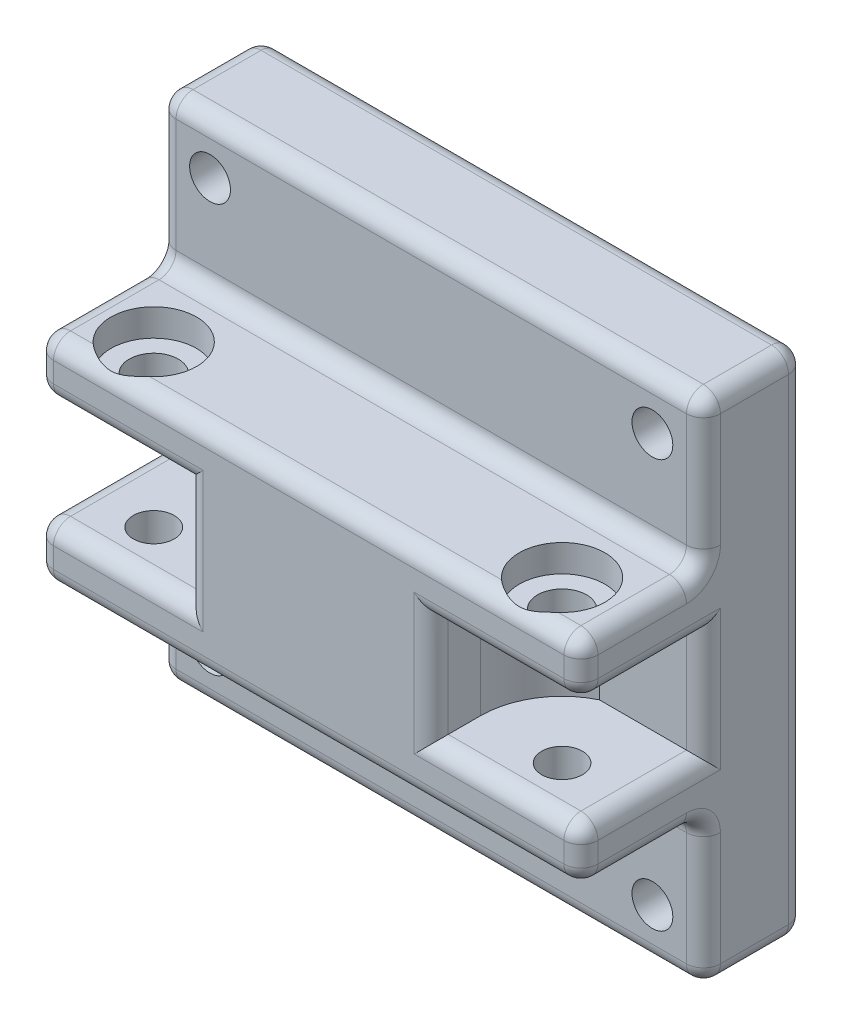
from build123d import *

# Parameters (mm, degrees)
SKETCH1_W           = 50.8
SKETCH1_H           = 47.625
BOSS_EXTRUDE1_DEPTH = 9.525
SKETCH2_R           = 1.905
CUT_EXTRUDE1_DEPTH  = 71.281620997
SKETCH3_W           = 50.8
SKETCH3_H           = 5.08
BOSS_EXTRUDE2_DEPTH = 11.43
CUT_EXTRUDE2_START  = -5.08
SKETCH4_R           = 2.286
CUT_EXTRUDE2_DEPTH  = 70.618902185
SKETCH5_R           = 4.0005
CUT_EXTRUDE3_DEPTH  = 2.54
BOSS_EXTRUDE3_DEPTH = 9.906
SKETCH9_R           = 1.905
CUT_EXTRUDE4_DEPTH  = 5.08
SKETCH11_R          = 1.905
CUT_EXTRUDE5_DEPTH  = 6.35
FILLET1_R           = 1.5875


with BuildPart() as part:
    # Sketch1 → Boss-Extrude1 (new body)
    with BuildSketch(Plane.XY):
        with Locations((25.4, 23.8125)):
            Rectangle(SKETCH1_W, SKETCH1_H)
    extrude(amount=BOSS_EXTRUDE1_DEPTH)

    # Sketch2 → Cut-Extrude1 (cut, through all)
    with BuildSketch(Plane.XY.offset(9.525)):
        with Locations((4.7625, 42.8625)):
            Circle(SKETCH2_R)
        with Locations((4.7625, 4.7625)):
            Circle(SKETCH2_R)
    cut_extrude1 = extrude(amount=-CUT_EXTRUDE1_DEPTH, mode=Mode.SUBTRACT)

    # Sketch3 → Boss-Extrude2 (add)
    with BuildSketch(Plane.XY.offset(9.525)):
        with Locations((25.4, 31.3055)):
            Rectangle(SKETCH3_W, SKETCH3_H)
        with Locations((25.4, 16.3195)):
            Rectangle(SKETCH3_W, SKETCH3_H)
    extrude(amount=BOSS_EXTRUDE2_DEPTH)

    # Sketch4 → Cut-Extrude2 (cut)
    with BuildSketch(Plane(origin=(0, 33.8455, 0), x_dir=(1, 0, 0), z_dir=(0, 1, 0)).offset(CUT_EXTRUDE2_START)):
        with Locations(Location((6.35, -16.36395, 0), (0, 0, 270))):
            Circle(SKETCH4_R)
    cut_extrude2 = extrude(amount=CUT_EXTRUDE2_DEPTH, mode=Mode.SUBTRACT)

    # Mirror3: Cut-Extrude1, Cut-Extrude2 across plane
    add(cut_extrude1.mirror(Plane(origin=(25.4, 0, 0), x_dir=(0, 0, 1), z_dir=(1, 0, 0))), mode=Mode.SUBTRACT)
    add(cut_extrude2.mirror(Plane(origin=(25.4, 0, 0), x_dir=(0, 0, 1), z_dir=(1, 0, 0))), mode=Mode.SUBTRACT)

    # Sketch5 → Cut-Extrude3 (cut)
    with BuildSketch(Plane(origin=(0, 33.8455, 0), x_dir=(1, 0, 0), z_dir=(0, 1, 0))):
        with Locations(Location((6.35, -16.36395, 0), (0, 0, 270))):
            Circle(SKETCH5_R)
        with Locations(Location((44.45, -16.36395, 0), (0, 0, 270))):
            Circle(SKETCH5_R)
    extrude(amount=-CUT_EXTRUDE3_DEPTH, mode=Mode.SUBTRACT)

    # Sketch8 → Boss-Extrude3 (add)
    with BuildSketch(Plane(origin=(0, 18.8595, 0), x_dir=(1, 0, 0), z_dir=(0, 1, 0))):
        with BuildLine():
            Line((36.83, -16.36395), (36.83, -20.955))
            Line((36.83, -20.955), (13.97, -20.955))
            Line((13.97, -20.955), (13.97, -16.36395))
            ThreePointArc((13.97, -16.36395), (12.818061524, -12.335478811), (9.710530151, -9.525))
            Line((9.710530151, -9.525), (41.089469849, -9.525))
            ThreePointArc((41.089469849, -9.525), (37.981938476, -12.335478811), (36.83, -16.36395))
        make_face()
    extrude(amount=BOSS_EXTRUDE3_DEPTH)

    # Sketch9 → Cut-Extrude4 (cut)
    with BuildSketch(Plane(origin=(0, 18.8595, 0), x_dir=(1, 0, 0), z_dir=(0, 1, 0))):
        with Locations(Location((44.45, -16.36395, 0), (0, 0, 270))):
            Circle(SKETCH9_R)
        with Locations(Location((6.35, -16.36395, 0), (0, 0, 270))):
            Circle(SKETCH9_R)
    extrude(amount=-CUT_EXTRUDE4_DEPTH, mode=Mode.SUBTRACT)

    # Sketch11 → Cut-Extrude5 (cut)
    with BuildSketch(Plane(origin=(0, 0, 0), x_dir=(-1, 0, 0), z_dir=(0, 0, -1))):
        with Locations((-44.45, 30.1625)):
            Circle(SKETCH11_R)
        with Locations((-44.45, 17.4625)):
            Circle(SKETCH11_R)
        with Locations(Location((-6.35, 17.4625, 0), (0, 0, 180))):
            Circle(SKETCH11_R)
        with Locations(Location((-6.35, 30.1625, 0), (0, 0, 180))):
            Circle(SKETCH11_R)
    extrude(amount=-CUT_EXTRUDE5_DEPTH, mode=Mode.SUBTRACT)

    # Fillet1
    # the kernel refuses this fillet: 1.5875 mm, written as the material it adds along each edge
    with BuildSketch(Plane(origin=(0, 33.8455, 9.525), x_dir=(0, 1, 0), z_dir=(1, 0, 0))) as fillet1_piece_1:
        with BuildLine():
            CenterArc((FILLET1_R, FILLET1_R), FILLET1_R, 180, 90)
            Line((0, FILLET1_R), (0, 0))
            Line((0, 0), (FILLET1_R, 0))
        make_face()
    extrude(amount=50.8)
    with BuildSketch(Plane(origin=(0, 13.7795, 9.525), x_dir=(0, -1, 0), z_dir=(1, 0, 0))) as fillet1_piece_2:
        with BuildLine():
            CenterArc((FILLET1_R, -FILLET1_R), FILLET1_R, 90, 90)
            Line((0, -FILLET1_R), (0, 0))
            Line((0, 0), (FILLET1_R, 0))
        make_face()
    extrude(amount=50.8)
    # the kernel refuses this fillet: 1.5875 mm, written as the material it takes off along each edge
    with BuildSketch(Plane(origin=(1.5875, 30.353, 19.3675), x_dir=(-1, 0, 0), z_dir=(0, 0, 1))) as fillet1_2_piece_1_section:
        Polygon((0, 0), (FILLET1_R, 0), (FILLET1_R, FILLET1_R), (0, FILLET1_R), align=None)
    fillet1_2_piece_1 = extrude(amount=FILLET1_R, mode=Mode.PRIVATE)
    fillet1_2_piece_1 = fillet1_2_piece_1 - Plane(origin=(1.5875, 30.353, 19.3675), x_dir=(0.7071067811865475, 0.7071067811865477, 0), z_dir=(0, 0, 1)) * Sphere(FILLET1_R, mode=Mode.PRIVATE)
    add(fillet1_2_piece_1, mode=Mode.SUBTRACT)
    with BuildSketch(Plane(origin=(49.2125, 30.353, 19.3675), x_dir=(1, 0, 0), z_dir=(0, 0, 1))) as fillet1_2_piece_2_section:
        Polygon((0, 0), (FILLET1_R, 0), (FILLET1_R, -FILLET1_R), (0, -FILLET1_R), align=None)
    fillet1_2_piece_2 = extrude(amount=FILLET1_R, mode=Mode.PRIVATE)
    fillet1_2_piece_2 = fillet1_2_piece_2 - Plane(origin=(49.2125, 30.353, 19.3675), x_dir=(-0.7071067811865476, 0.7071067811865475, 0), z_dir=(0, 0, 1)) * Sphere(FILLET1_R, mode=Mode.PRIVATE)
    add(fillet1_2_piece_2, mode=Mode.SUBTRACT)
    with BuildSketch(Plane(origin=(1.5875, 17.272, 19.3675), x_dir=(-1, 0, 0), z_dir=(0, 0, 1))) as fillet1_2_piece_3_section:
        Polygon((0, 0), (FILLET1_R, 0), (FILLET1_R, -FILLET1_R), (0, -FILLET1_R), align=None)
    fillet1_2_piece_3 = extrude(amount=FILLET1_R, mode=Mode.PRIVATE)
    fillet1_2_piece_3 = fillet1_2_piece_3 - Plane(origin=(1.5875, 17.272, 19.3675), x_dir=(0.7071067811865476, -0.7071067811865475, 0), z_dir=(0, 0, 1)) * Sphere(FILLET1_R, mode=Mode.PRIVATE)
    add(fillet1_2_piece_3, mode=Mode.SUBTRACT)
    with BuildSketch(Plane(origin=(49.2125, 17.272, 19.3675), x_dir=(1, 0, 0), z_dir=(0, 0, 1))) as fillet1_2_piece_4_section:
        Polygon((0, 0), (FILLET1_R, 0), (FILLET1_R, FILLET1_R), (0, FILLET1_R), align=None)
    fillet1_2_piece_4 = extrude(amount=FILLET1_R, mode=Mode.PRIVATE)
    fillet1_2_piece_4 = fillet1_2_piece_4 - Plane(origin=(49.2125, 17.272, 19.3675), x_dir=(-0.7071067811865475, -0.7071067811865477, 0), z_dir=(0, 0, 1)) * Sphere(FILLET1_R, mode=Mode.PRIVATE)
    add(fillet1_2_piece_4, mode=Mode.SUBTRACT)
    with BuildSketch(Plane(origin=(49.2125, 46.0375, 1.5875), x_dir=(0, 0, -1), z_dir=(1, 0, 0))) as fillet1_2_piece_5_section:
        Polygon((0, 0), (FILLET1_R, 0), (FILLET1_R, FILLET1_R), (0, FILLET1_R), align=None)
    fillet1_2_piece_5 = extrude(amount=FILLET1_R, mode=Mode.PRIVATE)
    fillet1_2_piece_5 = fillet1_2_piece_5 - Plane(origin=(49.2125, 46.0375, 1.5875), x_dir=(0, -0.7071067811865475, 0.7071067811865475), z_dir=(1, 0, 0)) * Sphere(FILLET1_R, mode=Mode.PRIVATE)
    add(fillet1_2_piece_5, mode=Mode.SUBTRACT)
    with BuildSketch(Plane(origin=(1.5875, 46.0375, 1.5875), x_dir=(0, 0, -1), z_dir=(-1, 0, 0))) as fillet1_2_piece_6_section:
        Polygon((0, 0), (FILLET1_R, 0), (FILLET1_R, -FILLET1_R), (0, -FILLET1_R), align=None)
    fillet1_2_piece_6 = extrude(amount=FILLET1_R, mode=Mode.PRIVATE)
    fillet1_2_piece_6 = fillet1_2_piece_6 - Plane(origin=(1.5875, 46.0375, 1.5875), x_dir=(0, -0.7071067811865475, 0.7071067811865475), z_dir=(-1, 0, 0)) * Sphere(FILLET1_R, mode=Mode.PRIVATE)
    add(fillet1_2_piece_6, mode=Mode.SUBTRACT)
    with BuildSketch(Plane(origin=(49.2125, 1.5875, 1.5875), x_dir=(1, 0, 0), z_dir=(0, -1, 0))) as fillet1_2_piece_7_section:
        Polygon((0, 0), (FILLET1_R, 0), (FILLET1_R, -FILLET1_R), (0, -FILLET1_R), align=None)
    fillet1_2_piece_7 = extrude(amount=FILLET1_R, mode=Mode.PRIVATE)
    fillet1_2_piece_7 = fillet1_2_piece_7 - Plane(origin=(49.2125, 1.5875, 1.5875), x_dir=(-0.7071067811865475, 0, 0.7071067811865475), z_dir=(0, -1, 0)) * Sphere(FILLET1_R, mode=Mode.PRIVATE)
    add(fillet1_2_piece_7, mode=Mode.SUBTRACT)
    with BuildSketch(Plane(origin=(1.5875, 1.5875, 1.5875), x_dir=(-1, 0, 0), z_dir=(0, -1, 0))) as fillet1_2_piece_8_section:
        Polygon((0, 0), (FILLET1_R, 0), (FILLET1_R, FILLET1_R), (0, FILLET1_R), align=None)
    fillet1_2_piece_8 = extrude(amount=FILLET1_R, mode=Mode.PRIVATE)
    fillet1_2_piece_8 = fillet1_2_piece_8 - Plane(origin=(1.5875, 1.5875, 1.5875), x_dir=(0.7071067811865475, 0, 0.7071067811865475), z_dir=(0, -1, 0)) * Sphere(FILLET1_R, mode=Mode.PRIVATE)
    add(fillet1_2_piece_8, mode=Mode.SUBTRACT)
    with BuildSketch(Plane(origin=(54.76875, 47.625, 9.525), x_dir=(0, 0, -1), z_dir=(-1, 0, 0)), Plane(origin=(-3.96875, 0, 9.525), x_dir=(0, 0, -1), z_dir=(1, 0, 0))) as fillet1_2_piece_9:
        with BuildLine():
            CenterArc((FILLET1_R, FILLET1_R), FILLET1_R, 180, 90)
            Line((0, FILLET1_R), (0, 0))
            Line((0, 0), (FILLET1_R, 0))
        make_face()
    extrude(amount=58.7375, mode=Mode.SUBTRACT)
    with BuildSketch(Plane(origin=(0, 28.7655, 9.525), x_dir=(0, 0, -1), z_dir=(0, -1, 0)), Plane(origin=(50.8, 18.8595, 9.525), x_dir=(0, 0, -1), z_dir=(0, 1, 0)), Plane(origin=(13.97, 18.8595, 20.955), x_dir=(1, 0, 0), z_dir=(0, 1, 0))) as fillet1_2_piece_10:
        with BuildLine():
            CenterArc((FILLET1_R, FILLET1_R), FILLET1_R, 180, 90)
            Line((0, FILLET1_R), (0, 0))
            Line((0, 0), (FILLET1_R, 0))
        make_face()
    extrude(amount=9.906, mode=Mode.SUBTRACT)
    with BuildSketch(Plane(origin=(0, 28.7655, 9.525), x_dir=(0, 1, 0), z_dir=(0, 0, 1)), Plane(origin=(50.8, 18.8595, 9.525), x_dir=(0, -1, 0), z_dir=(0, 0, 1))) as fillet1_2_piece_11:
        with BuildLine():
            CenterArc((FILLET1_R, -FILLET1_R), FILLET1_R, 90, 90)
            Line((0, -FILLET1_R), (0, 0))
            Line((0, 0), (FILLET1_R, 0))
        make_face()
    extrude(amount=9.8425, mode=Mode.SUBTRACT)
    with BuildSketch(Plane(origin=(50.8, 28.7655, 9.525), x_dir=(0, 1, 0), z_dir=(0, 0, 1)), Plane(origin=(0, 18.8595, 9.525), x_dir=(0, -1, 0), z_dir=(0, 0, 1))) as fillet1_2_piece_12:
        with BuildLine():
            CenterArc((FILLET1_R, FILLET1_R), FILLET1_R, 180, 90)
            Line((0, FILLET1_R), (0, 0))
            Line((0, 0), (FILLET1_R, 0))
        make_face()
    extrude(amount=9.8425, mode=Mode.SUBTRACT)
    with BuildSketch(Plane(origin=(0, 30.353, 20.955), x_dir=(0, 0, -1), z_dir=(0, 1, 0)), Plane(origin=(50.8, 37.81425, 20.955), x_dir=(0, 0, -1), z_dir=(0, -1, 0))) as fillet1_2_piece_13:
        with BuildLine():
            CenterArc((FILLET1_R, -FILLET1_R), FILLET1_R, 90, 90)
            Line((0, -FILLET1_R), (0, 0))
            Line((0, 0), (FILLET1_R, 0))
        make_face()
    extrude(amount=7.46125, mode=Mode.SUBTRACT)
    with BuildSketch(Plane(origin=(13.97, 28.7655, 20.955), x_dir=(0, 1, 0), z_dir=(-1, 0, 0)), Plane(origin=(49.2125, 28.7655, 20.955), x_dir=(0, 1, 0), z_dir=(-1, 0, 0))) as fillet1_2_piece_14:
        with BuildLine():
            CenterArc((FILLET1_R, FILLET1_R), FILLET1_R, 180, 90)
            Line((0, FILLET1_R), (0, 0))
            Line((0, 0), (FILLET1_R, 0))
        make_face()
    extrude(amount=12.3825, mode=Mode.SUBTRACT)
    with BuildSketch(Plane(origin=(-3.96875, 33.8455, 20.955), x_dir=(0, 0, -1), z_dir=(1, 0, 0)), Plane(origin=(-3.96875, 13.7795, 20.955), x_dir=(0, 1, 0), z_dir=(1, 0, 0))) as fillet1_2_piece_15:
        with BuildLine():
            CenterArc((FILLET1_R, -FILLET1_R), FILLET1_R, 90, 90)
            Line((0, -FILLET1_R), (0, 0))
            Line((0, 0), (FILLET1_R, 0))
        make_face()
    extrude(amount=58.7375, mode=Mode.SUBTRACT)
    with BuildSketch(Plane(origin=(0, 17.272, 20.955), x_dir=(0, 0, -1), z_dir=(0, -1, 0)), Plane(origin=(50.8, 9.81075, 20.955), x_dir=(0, 0, -1), z_dir=(0, 1, 0))) as fillet1_2_piece_16:
        with BuildLine():
            CenterArc((FILLET1_R, FILLET1_R), FILLET1_R, 180, 90)
            Line((0, FILLET1_R), (0, 0))
            Line((0, 0), (FILLET1_R, 0))
        make_face()
    extrude(amount=7.46125, mode=Mode.SUBTRACT)
    with BuildSketch(Plane(origin=(49.2125, 18.8595, 20.955), x_dir=(0, -1, 0), z_dir=(-1, 0, 0)), Plane(origin=(13.97, 18.8595, 20.955), x_dir=(0, -1, 0), z_dir=(-1, 0, 0))) as fillet1_2_piece_17:
        with BuildLine():
            CenterArc((FILLET1_R, -FILLET1_R), FILLET1_R, 90, 90)
            Line((0, -FILLET1_R), (0, 0))
            Line((0, 0), (FILLET1_R, 0))
        make_face()
    extrude(amount=12.3825, mode=Mode.SUBTRACT)
    with BuildSketch(Plane(origin=(49.2125, 47.625, 0), x_dir=(0, -1, 0), z_dir=(-1, 0, 0))) as fillet1_2_piece_18:
        with BuildLine():
            CenterArc((FILLET1_R, FILLET1_R), FILLET1_R, 180, 90)
            Line((0, FILLET1_R), (0, 0))
            Line((0, 0), (FILLET1_R, 0))
        make_face()
    extrude(amount=47.625, mode=Mode.SUBTRACT)
    with BuildSketch(Plane(origin=(50.8, 1.5875, 0), x_dir=(0, 0, 1), z_dir=(0, 1, 0)), Plane(origin=(0, 46.0375, 0), x_dir=(0, 0, 1), z_dir=(0, -1, 0))) as fillet1_2_piece_19:
        with BuildLine():
            CenterArc((FILLET1_R, -FILLET1_R), FILLET1_R, 90, 90)
            Line((0, -FILLET1_R), (0, 0))
            Line((0, 0), (FILLET1_R, 0))
        make_face()
    extrude(amount=44.45, mode=Mode.SUBTRACT)
    with BuildSketch(Plane(origin=(1.5875, 0, 0), x_dir=(0, 0, 1), z_dir=(1, 0, 0))) as fillet1_2_piece_20:
        with BuildLine():
            CenterArc((FILLET1_R, -FILLET1_R), FILLET1_R, 90, 90)
            Line((0, -FILLET1_R), (0, 0))
            Line((0, 0), (FILLET1_R, 0))
        make_face()
    extrude(amount=47.625, mode=Mode.SUBTRACT)
    with BuildSketch(Plane(origin=(0, 47.625, 1.5875), x_dir=(0, -1, 0), z_dir=(0, 0, 1)), Plane(origin=(0, 0, 1.5875), x_dir=(1, 0, 0), z_dir=(0, 0, 1))) as fillet1_2_piece_21:
        with BuildLine():
            CenterArc((FILLET1_R, FILLET1_R), FILLET1_R, 180, 90)
            Line((0, FILLET1_R), (0, 0))
            Line((0, 0), (FILLET1_R, 0))
        make_face()
    extrude(amount=11.90625, mode=Mode.SUBTRACT)
    with BuildSketch(Plane(origin=(50.8, 47.625, 1.5875), x_dir=(0, -1, 0), z_dir=(0, 0, 1)), Plane(origin=(50.8, 0, 1.5875), x_dir=(-1, 0, 0), z_dir=(0, 0, 1))) as fillet1_2_piece_22:
        with BuildLine():
            CenterArc((FILLET1_R, -FILLET1_R), FILLET1_R, 90, 90)
            Line((0, -FILLET1_R), (0, 0))
            Line((0, 0), (FILLET1_R, 0))
        make_face()
    extrude(amount=11.90625, mode=Mode.SUBTRACT)
    with BuildSketch(Plane(origin=(36.83, 18.8595, 20.955), x_dir=(-1, 0, 0), z_dir=(0, 1, 0))) as fillet1_2_piece_23:
        with BuildLine():
            CenterArc((FILLET1_R, -FILLET1_R), FILLET1_R, 90, 90)
            Line((0, -FILLET1_R), (0, 0))
            Line((0, 0), (FILLET1_R, 0))
        make_face()
    extrude(amount=9.906, mode=Mode.SUBTRACT)
    with BuildSketch(Plane(origin=(0, 28.7655, 5.55625), x_dir=(0, 1, 0), z_dir=(0, 0, 1))) as fillet1_2_piece_24a_section:
        with BuildLine():
            CenterArc((FILLET1_R, -FILLET1_R), FILLET1_R, 90, 90)
            Line((0, -FILLET1_R), (0, 0))
            Line((0, 0), (FILLET1_R, 0))
        make_face()
    fillet1_2_piece_24a = extrude(amount=13.81125, mode=Mode.PRIVATE)
    fillet1_2_piece_24a = split(fillet1_2_piece_24a, bisect_by=Plane(origin=(0.359402244, 29.124902244, 9.525), z_dir=(0, 0, -1)), keep=Keep.TOP, mode=Mode.PRIVATE)
    with BuildSketch(Plane(origin=(0, 32.73425, 9.525), x_dir=(0, 0, -1), z_dir=(0, -1, 0))) as fillet1_2_piece_24b_section:
        with BuildLine():
            CenterArc((FILLET1_R, FILLET1_R), FILLET1_R, 180, 90)
            Line((0, FILLET1_R), (0, 0))
            Line((0, 0), (FILLET1_R, 0))
        make_face()
    fillet1_2_piece_24b = extrude(amount=13.87475, mode=Mode.PRIVATE)
    fillet1_2_piece_24b = split(fillet1_2_piece_24b, bisect_by=Plane(origin=(0.359402244, 28.7655, 9.165597756), z_dir=(0, 1, 0)), keep=Keep.TOP, mode=Mode.PRIVATE)
    fillet1_2_piece_24 = fillet1_2_piece_24a & fillet1_2_piece_24b
    add(fillet1_2_piece_24, mode=Mode.SUBTRACT)
    with BuildSketch(Plane(origin=(0, 28.7655, 9.525), x_dir=(0, 0, -1), z_dir=(0, -1, 0))) as fillet1_2_piece_25a_section:
        with BuildLine():
            CenterArc((FILLET1_R, FILLET1_R), FILLET1_R, 180, 90)
            Line((0, FILLET1_R), (0, 0))
            Line((0, 0), (FILLET1_R, 0))
        make_face()
    fillet1_2_piece_25a = extrude(amount=13.87475, mode=Mode.PRIVATE)
    fillet1_2_piece_25a = split(fillet1_2_piece_25a, bisect_by=Plane(origin=(0.359402244, 18.8595, 9.165597756), z_dir=(0, -1, 0)), keep=Keep.TOP, mode=Mode.PRIVATE)
    with BuildSketch(Plane(origin=(0, 18.8595, 5.55625), x_dir=(0, -1, 0), z_dir=(0, 0, 1))) as fillet1_2_piece_25b_section:
        with BuildLine():
            CenterArc((FILLET1_R, FILLET1_R), FILLET1_R, 180, 90)
            Line((0, FILLET1_R), (0, 0))
            Line((0, 0), (FILLET1_R, 0))
        make_face()
    fillet1_2_piece_25b = extrude(amount=13.81125, mode=Mode.PRIVATE)
    fillet1_2_piece_25b = split(fillet1_2_piece_25b, bisect_by=Plane(origin=(0.359402244, 18.500097756, 9.525), z_dir=(0, 0, -1)), keep=Keep.TOP, mode=Mode.PRIVATE)
    fillet1_2_piece_25 = fillet1_2_piece_25a & fillet1_2_piece_25b
    add(fillet1_2_piece_25, mode=Mode.SUBTRACT)
    with BuildSketch(Plane(origin=(50.8, 18.8595, 9.525), x_dir=(0, 0, -1), z_dir=(0, 1, 0))) as fillet1_2_piece_26a_section:
        with BuildLine():
            CenterArc((FILLET1_R, FILLET1_R), FILLET1_R, 180, 90)
            Line((0, FILLET1_R), (0, 0))
            Line((0, 0), (FILLET1_R, 0))
        make_face()
    fillet1_2_piece_26a = extrude(amount=13.87475, mode=Mode.PRIVATE)
    fillet1_2_piece_26a = split(fillet1_2_piece_26a, bisect_by=Plane(origin=(50.440597756, 28.7655, 9.165597756), z_dir=(0, 1, 0)), keep=Keep.TOP, mode=Mode.PRIVATE)
    with BuildSketch(Plane(origin=(50.8, 28.7655, 5.55625), x_dir=(0, 1, 0), z_dir=(0, 0, 1))) as fillet1_2_piece_26b_section:
        with BuildLine():
            CenterArc((FILLET1_R, FILLET1_R), FILLET1_R, 180, 90)
            Line((0, FILLET1_R), (0, 0))
            Line((0, 0), (FILLET1_R, 0))
        make_face()
    fillet1_2_piece_26b = extrude(amount=13.81125, mode=Mode.PRIVATE)
    fillet1_2_piece_26b = split(fillet1_2_piece_26b, bisect_by=Plane(origin=(50.440597756, 29.124902244, 9.525), z_dir=(0, 0, -1)), keep=Keep.TOP, mode=Mode.PRIVATE)
    fillet1_2_piece_26 = fillet1_2_piece_26a & fillet1_2_piece_26b
    add(fillet1_2_piece_26, mode=Mode.SUBTRACT)
    with BuildSketch(Plane(origin=(13.97, 18.8595, 20.955), x_dir=(1, 0, 0), z_dir=(0, 1, 0))) as fillet1_2_piece_27a_section:
        with BuildLine():
            CenterArc((FILLET1_R, FILLET1_R), FILLET1_R, 180, 90)
            Line((0, FILLET1_R), (0, 0))
            Line((0, 0), (FILLET1_R, 0))
        make_face()
    fillet1_2_piece_27a = extrude(amount=13.87475, mode=Mode.PRIVATE)
    fillet1_2_piece_27a = split(fillet1_2_piece_27a, bisect_by=Plane(origin=(14.329402244, 28.7655, 20.595597756), z_dir=(0, 1, 0)), keep=Keep.TOP, mode=Mode.PRIVATE)
    with BuildSketch(Plane(origin=(17.93875, 28.7655, 20.955), x_dir=(0, 1, 0), z_dir=(-1, 0, 0))) as fillet1_2_piece_27b_section:
        with BuildLine():
            CenterArc((FILLET1_R, FILLET1_R), FILLET1_R, 180, 90)
            Line((0, FILLET1_R), (0, 0))
            Line((0, 0), (FILLET1_R, 0))
        make_face()
    fillet1_2_piece_27b = extrude(amount=16.35125, mode=Mode.PRIVATE)
    fillet1_2_piece_27b = split(fillet1_2_piece_27b, bisect_by=Plane(origin=(13.97, 29.124902244, 20.595597756), z_dir=(1, 0, 0)), keep=Keep.TOP, mode=Mode.PRIVATE)
    fillet1_2_piece_27 = fillet1_2_piece_27a & fillet1_2_piece_27b
    add(fillet1_2_piece_27, mode=Mode.SUBTRACT)
    with BuildSketch(Plane(origin=(50.8, 18.8595, 5.55625), x_dir=(0, -1, 0), z_dir=(0, 0, 1))) as fillet1_2_piece_28a_section:
        with BuildLine():
            CenterArc((FILLET1_R, -FILLET1_R), FILLET1_R, 90, 90)
            Line((0, -FILLET1_R), (0, 0))
            Line((0, 0), (FILLET1_R, 0))
        make_face()
    fillet1_2_piece_28a = extrude(amount=13.81125, mode=Mode.PRIVATE)
    fillet1_2_piece_28a = split(fillet1_2_piece_28a, bisect_by=Plane(origin=(50.440597756, 18.500097756, 9.525), z_dir=(0, 0, -1)), keep=Keep.TOP, mode=Mode.PRIVATE)
    with BuildSketch(Plane(origin=(50.8, 14.89075, 9.525), x_dir=(0, 0, -1), z_dir=(0, 1, 0))) as fillet1_2_piece_28b_section:
        with BuildLine():
            CenterArc((FILLET1_R, FILLET1_R), FILLET1_R, 180, 90)
            Line((0, FILLET1_R), (0, 0))
            Line((0, 0), (FILLET1_R, 0))
        make_face()
    fillet1_2_piece_28b = extrude(amount=13.87475, mode=Mode.PRIVATE)
    fillet1_2_piece_28b = split(fillet1_2_piece_28b, bisect_by=Plane(origin=(50.440597756, 18.8595, 9.165597756), z_dir=(0, -1, 0)), keep=Keep.TOP, mode=Mode.PRIVATE)
    fillet1_2_piece_28 = fillet1_2_piece_28a & fillet1_2_piece_28b
    add(fillet1_2_piece_28, mode=Mode.SUBTRACT)
    with BuildSketch(Plane(origin=(36.83, 14.89075, 20.955), x_dir=(-1, 0, 0), z_dir=(0, 1, 0))) as fillet1_2_piece_29a_section:
        with BuildLine():
            CenterArc((FILLET1_R, -FILLET1_R), FILLET1_R, 90, 90)
            Line((0, -FILLET1_R), (0, 0))
            Line((0, 0), (FILLET1_R, 0))
        make_face()
    fillet1_2_piece_29a = extrude(amount=13.87475, mode=Mode.PRIVATE)
    fillet1_2_piece_29a = split(fillet1_2_piece_29a, bisect_by=Plane(origin=(36.470597756, 18.8595, 20.595597756), z_dir=(0, -1, 0)), keep=Keep.TOP, mode=Mode.PRIVATE)
    with BuildSketch(Plane(origin=(49.2125, 18.8595, 20.955), x_dir=(0, -1, 0), z_dir=(-1, 0, 0))) as fillet1_2_piece_29b_section:
        with BuildLine():
            CenterArc((FILLET1_R, -FILLET1_R), FILLET1_R, 90, 90)
            Line((0, -FILLET1_R), (0, 0))
            Line((0, 0), (FILLET1_R, 0))
        make_face()
    fillet1_2_piece_29b = extrude(amount=16.35125, mode=Mode.PRIVATE)
    fillet1_2_piece_29b = split(fillet1_2_piece_29b, bisect_by=Plane(origin=(36.83, 18.500097756, 20.595597756), z_dir=(-1, 0, 0)), keep=Keep.TOP, mode=Mode.PRIVATE)
    fillet1_2_piece_29 = fillet1_2_piece_29a & fillet1_2_piece_29b
    add(fillet1_2_piece_29, mode=Mode.SUBTRACT)
    with BuildSketch(Plane(origin=(17.93875, 18.8595, 20.955), x_dir=(0, -1, 0), z_dir=(-1, 0, 0))) as fillet1_2_piece_30a_section:
        with BuildLine():
            CenterArc((FILLET1_R, -FILLET1_R), FILLET1_R, 90, 90)
            Line((0, -FILLET1_R), (0, 0))
            Line((0, 0), (FILLET1_R, 0))
        make_face()
    fillet1_2_piece_30a = extrude(amount=16.35125, mode=Mode.PRIVATE)
    fillet1_2_piece_30a = split(fillet1_2_piece_30a, bisect_by=Plane(origin=(13.97, 18.500097756, 20.595597756), z_dir=(1, 0, 0)), keep=Keep.TOP, mode=Mode.PRIVATE)
    with BuildSketch(Plane(origin=(13.97, 14.89075, 20.955), x_dir=(1, 0, 0), z_dir=(0, 1, 0))) as fillet1_2_piece_30b_section:
        with BuildLine():
            CenterArc((FILLET1_R, FILLET1_R), FILLET1_R, 180, 90)
            Line((0, FILLET1_R), (0, 0))
            Line((0, 0), (FILLET1_R, 0))
        make_face()
    fillet1_2_piece_30b = extrude(amount=13.87475, mode=Mode.PRIVATE)
    fillet1_2_piece_30b = split(fillet1_2_piece_30b, bisect_by=Plane(origin=(14.329402244, 18.8595, 20.595597756), z_dir=(0, -1, 0)), keep=Keep.TOP, mode=Mode.PRIVATE)
    fillet1_2_piece_30 = fillet1_2_piece_30a & fillet1_2_piece_30b
    add(fillet1_2_piece_30, mode=Mode.SUBTRACT)
    with BuildSketch(Plane(origin=(49.2125, 28.7655, 20.955), x_dir=(0, 1, 0), z_dir=(-1, 0, 0))) as fillet1_2_piece_31a_section:
        with BuildLine():
            CenterArc((FILLET1_R, FILLET1_R), FILLET1_R, 180, 90)
            Line((0, FILLET1_R), (0, 0))
            Line((0, 0), (FILLET1_R, 0))
        make_face()
    fillet1_2_piece_31a = extrude(amount=16.35125, mode=Mode.PRIVATE)
    fillet1_2_piece_31a = split(fillet1_2_piece_31a, bisect_by=Plane(origin=(36.83, 29.124902244, 20.595597756), z_dir=(-1, 0, 0)), keep=Keep.TOP, mode=Mode.PRIVATE)
    with BuildSketch(Plane(origin=(36.83, 18.8595, 20.955), x_dir=(-1, 0, 0), z_dir=(0, 1, 0))) as fillet1_2_piece_31b_section:
        with BuildLine():
            CenterArc((FILLET1_R, -FILLET1_R), FILLET1_R, 90, 90)
            Line((0, -FILLET1_R), (0, 0))
            Line((0, 0), (FILLET1_R, 0))
        make_face()
    fillet1_2_piece_31b = extrude(amount=13.87475, mode=Mode.PRIVATE)
    fillet1_2_piece_31b = split(fillet1_2_piece_31b, bisect_by=Plane(origin=(36.470597756, 28.7655, 20.595597756), z_dir=(0, 1, 0)), keep=Keep.TOP, mode=Mode.PRIVATE)
    fillet1_2_piece_31 = fillet1_2_piece_31a & fillet1_2_piece_31b
    add(fillet1_2_piece_31, mode=Mode.SUBTRACT)
    # the kernel refuses this fillet: 1.5875 mm, written as the material it takes off along each edge
    with BuildSketch(Plane(origin=(1.5875, 46.0375, 7.9375), x_dir=(0, 0, 1), z_dir=(-1, 0, 0))) as fillet1_3_piece_1_section:
        Polygon((0, 0), (FILLET1_R, 0), (FILLET1_R, FILLET1_R), (0, FILLET1_R), align=None)
    fillet1_3_piece_1 = extrude(amount=FILLET1_R, mode=Mode.PRIVATE)
    fillet1_3_piece_1 = fillet1_3_piece_1 - Plane(origin=(1.5875, 46.0375, 7.9375), x_dir=(0, -0.7071067811865475, -0.7071067811865475), z_dir=(-1, 0, 0)) * Sphere(FILLET1_R, mode=Mode.PRIVATE)
    add(fillet1_3_piece_1, mode=Mode.SUBTRACT)
    with BuildSketch(Plane(origin=(49.2125, 15.367, 19.3675), x_dir=(0, -1, 0), z_dir=(1, 0, 0))) as fillet1_3_piece_2_section:
        Polygon((0, 0), (FILLET1_R, 0), (FILLET1_R, -FILLET1_R), (0, -FILLET1_R), align=None)
    fillet1_3_piece_2 = extrude(amount=FILLET1_R, mode=Mode.PRIVATE)
    fillet1_3_piece_2 = fillet1_3_piece_2 - Plane(origin=(49.2125, 15.367, 19.3675), x_dir=(0, 0.7071067811865475, -0.7071067811865475), z_dir=(1, 0, 0)) * Sphere(FILLET1_R, mode=Mode.PRIVATE)
    add(fillet1_3_piece_2, mode=Mode.SUBTRACT)
    with BuildSketch(Plane(origin=(1.5875, 15.367, 19.3675), x_dir=(0, -1, 0), z_dir=(-1, 0, 0))) as fillet1_3_piece_3_section:
        Polygon((0, 0), (FILLET1_R, 0), (FILLET1_R, FILLET1_R), (0, FILLET1_R), align=None)
    fillet1_3_piece_3 = extrude(amount=FILLET1_R, mode=Mode.PRIVATE)
    fillet1_3_piece_3 = fillet1_3_piece_3 - Plane(origin=(1.5875, 15.367, 19.3675), x_dir=(0, 0.7071067811865475, -0.7071067811865475), z_dir=(-1, 0, 0)) * Sphere(FILLET1_R, mode=Mode.PRIVATE)
    add(fillet1_3_piece_3, mode=Mode.SUBTRACT)
    with BuildSketch(Plane(origin=(1.5875, 1.5875, 7.9375), x_dir=(0, 0, 1), z_dir=(-1, 0, 0))) as fillet1_3_piece_4_section:
        Polygon((0, 0), (FILLET1_R, 0), (FILLET1_R, -FILLET1_R), (0, -FILLET1_R), align=None)
    fillet1_3_piece_4 = extrude(amount=FILLET1_R, mode=Mode.PRIVATE)
    fillet1_3_piece_4 = fillet1_3_piece_4 - Plane(origin=(1.5875, 1.5875, 7.9375), x_dir=(0, 0.7071067811865475, -0.7071067811865475), z_dir=(-1, 0, 0)) * Sphere(FILLET1_R, mode=Mode.PRIVATE)
    add(fillet1_3_piece_4, mode=Mode.SUBTRACT)
    with BuildSketch(Plane(origin=(49.2125, 32.258, 19.3675), x_dir=(0, 1, 0), z_dir=(1, 0, 0))) as fillet1_3_piece_5_section:
        Polygon((0, 0), (FILLET1_R, 0), (FILLET1_R, FILLET1_R), (0, FILLET1_R), align=None)
    fillet1_3_piece_5 = extrude(amount=FILLET1_R, mode=Mode.PRIVATE)
    fillet1_3_piece_5 = fillet1_3_piece_5 - Plane(origin=(49.2125, 32.258, 19.3675), x_dir=(0, -0.7071067811865475, -0.7071067811865475), z_dir=(1, 0, 0)) * Sphere(FILLET1_R, mode=Mode.PRIVATE)
    add(fillet1_3_piece_5, mode=Mode.SUBTRACT)
    with BuildSketch(Plane(origin=(1.5875, 32.258, 19.3675), x_dir=(0, 1, 0), z_dir=(-1, 0, 0))) as fillet1_3_piece_6_section:
        Polygon((0, 0), (FILLET1_R, 0), (FILLET1_R, -FILLET1_R), (0, -FILLET1_R), align=None)
    fillet1_3_piece_6 = extrude(amount=FILLET1_R, mode=Mode.PRIVATE)
    fillet1_3_piece_6 = fillet1_3_piece_6 - Plane(origin=(1.5875, 32.258, 19.3675), x_dir=(0, -0.7071067811865475, -0.7071067811865475), z_dir=(-1, 0, 0)) * Sphere(FILLET1_R, mode=Mode.PRIVATE)
    add(fillet1_3_piece_6, mode=Mode.SUBTRACT)
    with BuildSketch(Plane(origin=(49.2125, 46.0375, 7.9375), x_dir=(0, 0, 1), z_dir=(1, 0, 0))) as fillet1_3_piece_7_section:
        Polygon((0, 0), (FILLET1_R, 0), (FILLET1_R, -FILLET1_R), (0, -FILLET1_R), align=None)
    fillet1_3_piece_7 = extrude(amount=FILLET1_R, mode=Mode.PRIVATE)
    fillet1_3_piece_7 = fillet1_3_piece_7 - Plane(origin=(49.2125, 46.0375, 7.9375), x_dir=(0, -0.7071067811865475, -0.7071067811865475), z_dir=(1, 0, 0)) * Sphere(FILLET1_R, mode=Mode.PRIVATE)
    add(fillet1_3_piece_7, mode=Mode.SUBTRACT)
    with BuildSketch(Plane(origin=(49.2125, 1.5875, 7.9375), x_dir=(1, 0, 0), z_dir=(0, 0, 1))) as fillet1_3_piece_8_section:
        Polygon((0, 0), (FILLET1_R, 0), (FILLET1_R, -FILLET1_R), (0, -FILLET1_R), align=None)
    fillet1_3_piece_8 = extrude(amount=FILLET1_R, mode=Mode.PRIVATE)
    fillet1_3_piece_8 = fillet1_3_piece_8 - Plane(origin=(49.2125, 1.5875, 7.9375), x_dir=(-0.7071067811865476, 0.7071067811865475, 0), z_dir=(0, 0, 1)) * Sphere(FILLET1_R, mode=Mode.PRIVATE)
    add(fillet1_3_piece_8, mode=Mode.SUBTRACT)
    with BuildSketch(Plane(origin=(50.8, 1.5875, 9.525), x_dir=(-1, 0, 0), z_dir=(0, 1, 0))) as fillet1_3_piece_9:
        with BuildLine():
            CenterArc((FILLET1_R, -FILLET1_R), FILLET1_R, 90, 90)
            Line((0, -FILLET1_R), (0, 0))
            Line((0, 0), (FILLET1_R, 0))
        make_face()
    extrude(amount=10.6045, mode=Mode.SUBTRACT)
    with BuildSketch(Plane(origin=(50.8, 35.433, 9.525), x_dir=(0, 0, -1), z_dir=(0, 1, 0)), Plane(origin=(0, 12.192, 9.525), x_dir=(0, 0, -1), z_dir=(0, -1, 0)), Plane(origin=(0, 46.0375, 9.525), x_dir=(0, 0, -1), z_dir=(0, -1, 0))) as fillet1_3_piece_10:
        with BuildLine():
            CenterArc((FILLET1_R, FILLET1_R), FILLET1_R, 180, 90)
            Line((0, FILLET1_R), (0, 0))
            Line((0, 0), (FILLET1_R, 0))
        make_face()
    extrude(amount=10.6045, mode=Mode.SUBTRACT)
    with BuildSketch(Plane(origin=(0, 33.8455, 11.1125), x_dir=(0, -1, 0), z_dir=(0, 0, 1)), Plane(origin=(50.8, 13.7795, 11.1125), x_dir=(0, 1, 0), z_dir=(0, 0, 1))) as fillet1_3_piece_11:
        with BuildLine():
            CenterArc((FILLET1_R, FILLET1_R), FILLET1_R, 180, 90)
            Line((0, FILLET1_R), (0, 0))
            Line((0, 0), (FILLET1_R, 0))
        make_face()
    extrude(amount=8.255, mode=Mode.SUBTRACT)
    with BuildSketch(Plane(origin=(50.8, 33.8455, 11.1125), x_dir=(0, -1, 0), z_dir=(0, 0, 1)), Plane(origin=(0, 13.7795, 11.1125), x_dir=(0, 1, 0), z_dir=(0, 0, 1))) as fillet1_3_piece_12:
        with BuildLine():
            CenterArc((FILLET1_R, -FILLET1_R), FILLET1_R, 90, 90)
            Line((0, -FILLET1_R), (0, 0))
            Line((0, 0), (FILLET1_R, 0))
        make_face()
    extrude(amount=8.255, mode=Mode.SUBTRACT)
    with BuildSketch(Plane(origin=(0, 35.433, 11.1125), x_dir=(0, 0, -1), z_dir=(0, 1, 0))) as fillet1_3_piece_13:
        with BuildLine():
            CenterArc((1.5875 + FILLET1_R, -FILLET1_R), FILLET1_R, 90, 90)
            Line((1.5875, -FILLET1_R), (1.5875, 0))
            Line((1.5875, 0), (1.5875 + FILLET1_R, 0))
        make_face()
    revolve(axis=Axis((0, 35.433, 11.1125), (-1, 0, 0)), revolution_arc=90, mode=Mode.SUBTRACT)
    with BuildSketch(Plane(origin=(50.8, 12.192, 11.1125), x_dir=(0, 0, -1), z_dir=(0, -1, 0))) as fillet1_3_piece_14:
        with BuildLine():
            CenterArc((1.5875 + FILLET1_R, -FILLET1_R), FILLET1_R, 90, 90)
            Line((1.5875, -FILLET1_R), (1.5875, 0))
            Line((1.5875, 0), (1.5875 + FILLET1_R, 0))
        make_face()
    revolve(axis=Axis((50.8, 12.192, 11.1125), (1, 0, 0)), revolution_arc=90, mode=Mode.SUBTRACT)
    with BuildSketch(Plane(origin=(0, 12.192, 11.1125), x_dir=(0, 0, -1), z_dir=(0, -1, 0))) as fillet1_3_piece_15:
        with BuildLine():
            CenterArc((1.5875 + FILLET1_R, FILLET1_R), FILLET1_R, 180, 90)
            Line((1.5875, FILLET1_R), (1.5875, 0))
            Line((1.5875, 0), (1.5875 + FILLET1_R, 0))
        make_face()
    revolve(axis=Axis((0, 12.192, 11.1125), (1, 0, 0)), revolution_arc=90, mode=Mode.SUBTRACT)
    with BuildSketch(Plane(origin=(50.8, 35.433, 11.1125), x_dir=(0, 0, -1), z_dir=(0, 1, 0))) as fillet1_3_piece_16:
        with BuildLine():
            CenterArc((1.5875 + FILLET1_R, FILLET1_R), FILLET1_R, 180, 90)
            Line((1.5875, FILLET1_R), (1.5875, 0))
            Line((1.5875, 0), (1.5875 + FILLET1_R, 0))
        make_face()
    revolve(axis=Axis((50.8, 35.433, 11.1125), (-1, 0, 0)), revolution_arc=90, mode=Mode.SUBTRACT)


solid = part.part
